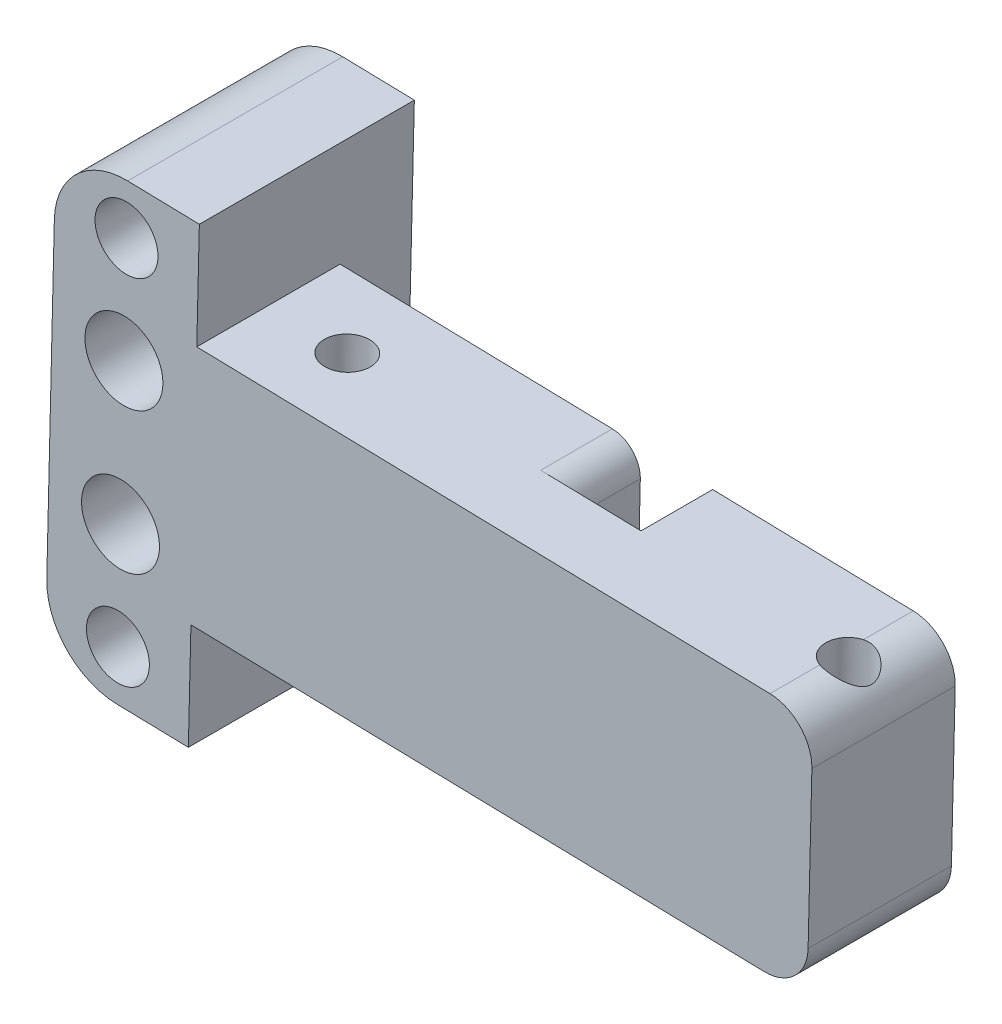
from build123d import *

# Parameters (mm, degrees)
EXTRUDE_1_DEPTH     = 15
CUT_EXTRUDE_1_DEPTH = 5
SKETCH_3_R          = 1.6
SKETCH_3_W          = 5
SKETCH_3_H          = 5
CUT_EXTRUDE_2_DEPTH = 22
FILLET_1_R          = 2
SKETCH_4_W          = 9.58124175
SKETCH_4_H          = 10
EXTRUDE_2_DEPTH     = 17
SKETCH_5_R          = 1.6
CUT_EXTRUDE_3_DEPTH = 18
FILLET_2_R          = 3


with BuildPart() as part:
    # 草图1 → 凸台-拉伸1 (new body)
    with BuildSketch(Plane.XY):
        with BuildLine():
            Line((24.185160084, -7.016301696), (24.496510845, 5.979969335))
            ThreePointArc((24.496510845, 5.979969335), (23.944762934, 7.407806858), (22.544984649, 8.027295764))
            Line((22.544984649, 8.027295764), (-13.444688974, 8.889497871))
            Line((-13.444688974, 8.889497871), (-13.265063535, 16.387346543))
            Line((-13.265063535, 16.387346543), (-18.263629316, 16.507096835))
            ThreePointArc((-18.263629316, 16.507096835), (-21.833223125, 15.127727058), (-23.38194539, 11.628281347))
            Line((-23.38194539, 11.628281347), (-23.908846678, -10.36540809))
            ThreePointArc((-23.908846678, -10.36540809), (-22.5294769, -13.935001898), (-19.030031189, -15.483724163))
            Line((-19.030031189, -15.483724163), (-14.031465408, -15.603474456))
            Line((-14.031465408, -15.603474456), (-13.851839969, -8.105625784))
            Line((-13.851839969, -8.105625784), (22.137833654, -8.967827891))
            ThreePointArc((22.137833654, -8.967827891), (23.565671178, -8.41607998), (24.185160084, -7.016301696))
        make_face()
        with BuildLine():
            ThreePointArc((-16.75044735, -12.037331753), (-18.893602347, -9.788969482), (-21.141964619, -11.93212448))
            ThreePointArc((-21.141964619, -11.93212448), (-18.998809621, -14.180486751), (-16.75044735, -12.037331753))
        make_face(mode=Mode.SUBTRACT)
        with BuildLine():
            ThreePointArc((-16.04728092, -4.552025517), (-18.701434473, -1.76757982), (-21.48588017, -4.421733373))
            ThreePointArc((-21.48588017, -4.421733373), (-18.831726617, -7.20617907), (-16.04728092, -4.552025517))
        make_face(mode=Mode.SUBTRACT)
        with BuildLine():
            ThreePointArc((-15.807780335, 5.445106045), (-18.461933888, 8.229551742), (-21.246379585, 5.575398189))
            ThreePointArc((-21.246379585, 5.575398189), (-18.592226032, 2.790952492), (-15.807780335, 5.445106045))
        make_face(mode=Mode.SUBTRACT)
        with BuildLine():
            ThreePointArc((-16.151695887, 12.955497152), (-18.294850884, 15.203859423), (-20.543213156, 13.060704426))
            ThreePointArc((-20.543213156, 13.060704426), (-18.400058158, 10.812342154), (-16.151695887, 12.955497152))
        make_face(mode=Mode.SUBTRACT)
    extrude(amount=-EXTRUDE_1_DEPTH)

    # 草图2 → 切除-拉伸1 (cut)
    with BuildSketch(Plane(origin=(0, 0, -15), x_dir=(-1, 0, 0), z_dir=(0, 0, -1))):
        Polygon((13.444688974, 8.889497871), (13.851839969, -8.105625784), (-33.415838559, -15.121344773), (-27.379501609, 15.743180277), align=None)
    extrude(amount=-CUT_EXTRUDE_1_DEPTH, mode=Mode.SUBTRACT)

    # 草图3 → 切除-拉伸2 (cut)
    with BuildSketch(Plane(origin=(0.205130979, 8.562490084, 0), x_dir=(0.9997131562086496, -0.02395005852477245, 0), z_dir=(0.02395005852477245, 0.9997131562086496, 0))):
        with Locations(Location((21.846263557, 5, 0), (0, 0, 288.209956864))):
            Circle(SKETCH_3_R)
        with Locations(Location((-8.153736443, 5, 0), (0, 0, 180))):
            Circle(SKETCH_3_R)
        with Locations((9.846263557, 7.5)):
            Rectangle(SKETCH_3_W, SKETCH_3_H)
    extrude(amount=-CUT_EXTRUDE_2_DEPTH, mode=Mode.SUBTRACT)

    # 圆角1
    fillet_1_edges = [part.edges().sort_by_distance(p)[0] for p in [
        (7.142136311, -8.608577013, -7.5),
        (7.549287306, 8.386546642, -7.5),
    ]]
    fillet(fillet_1_edges, radius=FILLET_1_R)

    # 草图4 → 凸台-拉伸2 (add)
    with BuildSketch(Plane(origin=(-0.202020016, -8.432633571, 0), x_dir=(0.9997131562086498, -0.023950058524770876, 0), z_dir=(-0.023950058524770876, -0.9997131562086498, 0))):
        with Locations((24.555642682, -5)):
            Rectangle(SKETCH_4_W, SKETCH_4_H)
    extrude(amount=-EXTRUDE_2_DEPTH)

    # 草图5 → 切除-拉伸3 (cut)
    with BuildSketch(Plane(origin=(-0.202020016, -8.432633571, 0), x_dir=(0.9997131562086498, -0.023950058524770876, 0), z_dir=(-0.023950058524770876, -0.9997131562086498, 0))):
        with Locations((26.846263557, -5)):
            Circle(SKETCH_5_R)
    extrude(amount=-CUT_EXTRUDE_3_DEPTH, mode=Mode.SUBTRACT)

    # 圆角2
    # the kernel refuses this fillet: 3 mm, written as the material it takes off along each edge
    with BuildSketch(Plane(origin=(29.135825748, -9.135478301, 7.5), x_dir=(-0.9997131562086498, 0.023950058524770713, 0), z_dir=(0, 0, -1)), Plane(origin=(29.542976743, 7.859645355, 7.5), x_dir=(-0.023950058524770713, -0.9997131562086498, 0), z_dir=(0, 0, -1))) as fillet_2_piece_1:
        with BuildLine():
            CenterArc((FILLET_2_R, FILLET_2_R), FILLET_2_R, 180, 90)
            Line((0, FILLET_2_R), (0, 0))
            Line((0, 0), (FILLET_2_R, 0))
        make_face()
    extrude(amount=25, mode=Mode.SUBTRACT)


solid = part.part
